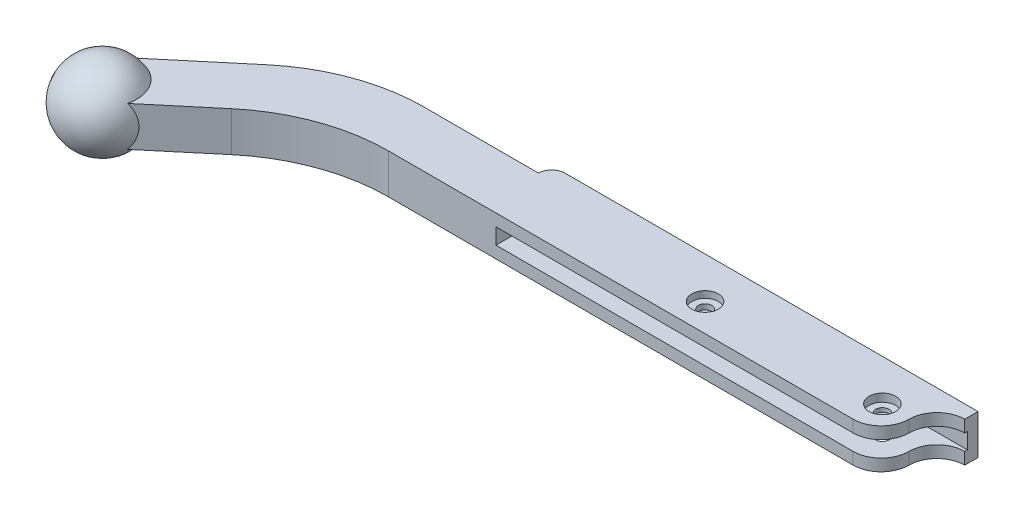
from build123d import *

# Parameters (mm, degrees)
SKETCH_1_W          = 150
SKETCH_1_H          = 21.000000000000004
EXTRUDE_1_DEPTH     = 15
CUT_EXTRUDE_1_DEPTH = 145
SKETCH_3_R          = 5.000000000000004
CUT_EXTRUDE_2_DEPTH = 3
CUT_EXTRUDE_START   = -3
SKETCH_4_R          = 5.000000000000001
CUT_EXTRUDE_3_DEPTH = 3
SKETCH_5_R          = 2.4999999999999987
CUT_EXTRUDE_4_DEPTH = 20
SKETCH_6_R          = 5.000000000000001
CUT_EXTRUDE_5_DEPTH = 20
SKETCH_7_R          = 5.999999999999998
EXTRUDE_2_DEPTH     = 2
SKETCH_8_R          = 6.000000000000003
EXTRUDE_3_DEPTH     = 2
SKETCH_9_R          = 2.500000000000002
CUT_EXTRUDE_6_DEPTH = 20
EXTRUDE_5_DEPTH     = 15
EXTRUDE_6_DEPTH     = 5
FILLET_1_R          = 5
FILLET_2_R          = 10.5
FILLET_3_R          = 67.5
SKETCH_17_W         = 22.000000000000004
SKETCH_17_H         = 5.999999999999995
CUT_EXTRUDE_7_DEPTH = 200


with BuildPart() as part:
    # 草图1 → 凸台-拉伸1 (new body)
    with BuildSketch(Plane(origin=(0, 0, 0), x_dir=(1, 0, 0), z_dir=(0, 1, 0))):
        with Locations((-32.52921535893155, 2.6552587646076753)):
            Rectangle(SKETCH_1_W, SKETCH_1_H)
    extrude(amount=EXTRUDE_1_DEPTH)

    # 草图2 → 切除-拉伸1 (cut)
    with BuildSketch(Plane(origin=(42.470784641068455, 0, 0), x_dir=(0, 0, -1), z_dir=(1, 0, 0))):
        Polygon((-7.844741235392326, 10.499999999999998), (13.155258764607675, 10.499999999999998), (13.155258764607675, 4.500000000000001), (-7.844741235392326, 4.5), align=None)
    extrude(amount=-CUT_EXTRUDE_1_DEPTH, mode=Mode.SUBTRACT)

    # 草图3 → 切除-拉伸2 (cut)
    with BuildSketch(Plane(origin=(0, 15, 0), x_dir=(1, 0, 0), z_dir=(0, 1, 0))):
        with Locations(Location((32.47078464106845, 2.655258764607675, 0), (0, 0, 270))):
            Circle(SKETCH_3_R)
    extrude(amount=-CUT_EXTRUDE_2_DEPTH, mode=Mode.SUBTRACT)

    # 草图4 → 切除-拉伸3 (cut)
    with BuildSketch(Plane(origin=(0, 0, 0), x_dir=(-1, 0, 0), z_dir=(0, -1, 0)).offset(CUT_EXTRUDE_START)):
        with Locations(Location((-32.47078464106845, 2.655258764607675, 0), (0, 0, 270))):
            Circle(SKETCH_4_R)
    extrude(amount=CUT_EXTRUDE_3_DEPTH, mode=Mode.SUBTRACT)

    # 草图5 → 切除-拉伸4 (cut)
    with BuildSketch(Plane(origin=(0, 3, 0), x_dir=(-1, 0, 0), z_dir=(0, -1, 0))):
        with Locations(Location((-32.47078464106845, 2.655258764607675, 0), (0, 0, 270))):
            Circle(SKETCH_5_R)
    extrude(amount=-CUT_EXTRUDE_4_DEPTH, mode=Mode.SUBTRACT)

    # 草图6 → 切除-拉伸5 (cut)
    with BuildSketch(Plane(origin=(0, 15, 0), x_dir=(1, 0, 0), z_dir=(0, 1, 0))):
        with Locations(Location((-34.295534758931545, 2.655258764607675, 0), (0, 0, 270))):
            Circle(SKETCH_6_R)
    extrude(amount=-CUT_EXTRUDE_5_DEPTH, mode=Mode.SUBTRACT)

    # 草图7 → 凸台-拉伸2 (add)
    with BuildSketch(Plane(origin=(0, 4.5, 1.9e-16), x_dir=(1, 0, 0), z_dir=(0, 1, 4e-17))):
        with Locations((-34.295534758931545, 2.655258764607675)):
            Circle(SKETCH_7_R)
    extrude(amount=-EXTRUDE_2_DEPTH)

    # 草图8 → 凸台-拉伸3 (add)
    with BuildSketch(Plane(origin=(0, 10.499999999999998, 0), x_dir=(-1, 0, 0), z_dir=(0, -1, 0))):
        with Locations((34.295534758931545, 2.655258764607675)):
            Circle(SKETCH_8_R)
    extrude(amount=-EXTRUDE_3_DEPTH)

    # 草图9 → 切除-拉伸6 (cut)
    with BuildSketch(Plane(origin=(0, 12.499999999999998, 0), x_dir=(1, 0, 0), z_dir=(0, 1, 0))):
        with Locations(Location((-34.295534758931545, 2.655258764607675, 0), (0, 0, 270))):
            Circle(SKETCH_9_R)
    extrude(amount=-CUT_EXTRUDE_6_DEPTH, mode=Mode.SUBTRACT)



with BuildPart() as body_2:
    # 草图12 → 凸台-拉伸5 (new body)
    with BuildSketch(Plane(origin=(0, 15, 0), x_dir=(1, 0, 0), z_dir=(0, 1, 0))):
        Polygon((-107.52921535893154, -7.844741235392326), (-167.52921535893154, -7.844741235392335), (-213.49188194607015, -46.41199781658475), (-226.9904217494875, -30.32506451108624), (-175.17259027852143, 13.155258764607666), (-107.52921535893154, 13.155258764607675), align=None)
    extrude(amount=-EXTRUDE_5_DEPTH)

    # 草图13 → 旋转3 (revolve)
    with BuildSketch(Plane(origin=(-148.13562673762334, 0, 124.30054975975524), x_dir=(0.6427876096865401, 0, 0.7660444431189775), z_dir=(-0.7660444431189775, 0, 0.6427876096865401))):
        with BuildLine():
            Line((-112.17628346215061, 22.5), (-112.17628346215061, -7.5))
            ThreePointArc((-112.17628346215061, -7.5), (-97.17628346215061, 7.5), (-112.17628346215061, 22.5))
        make_face()
    revolve(axis=Axis((-220.2411518477789, 22.5, 38.36853116383551), (0, -1, 0)))


with BuildPart() as part_1:
    add(part.part)

    add(body_2.part)  # 凸台-拉伸6 merges body 2
    # 草图14 → 凸台-拉伸6 (add)
    with BuildSketch(Plane(origin=(0, 0, -13.155258764607675), x_dir=(-1, 0, 0), z_dir=(0, 0, -1))):
        Polygon((107.52921535893154, 15), (-52.97078464106847, 14.99999999999998), (-52.97078464106847, -3.99e-14), (107.52921535893154, 0), align=None)
    extrude(amount=EXTRUDE_6_DEPTH)

    # 圆角1
    fillet_1_edges = [part_1.edges().sort_by_distance(p)[0] for p in [
        (-107.52921535893154, 7.5, -18.155258764607673),
    ]]
    fillet(fillet_1_edges, radius=FILLET_1_R - 0.0001)  # a hair under: the kernel refuses the full size

    # 圆角2
    fillet_2_edges = [part_1.edges().sort_by_distance(p)[0] for p in [
        (42.470784641068455, 12.75, -13.155258764607675),
    ]]
    fillet(fillet_2_edges, radius=FILLET_2_R - 0.0001)  # a hair under: the kernel refuses the full size
    fillet_2_2_edges = [part_1.edges().sort_by_distance(p)[0] for p in [
        (42.470784641068455, 2.2500000000000004, -13.155258764607675),
    ]]
    fillet(fillet_2_2_edges, radius=FILLET_2_R - 0.0001)  # a hair under: the kernel refuses the full size
    fillet_2_3_edges = [part_1.edges().sort_by_distance(p)[0] for p in [
        (42.470784641068455, 2.25, 7.844741235392326),
    ]]
    fillet(fillet_2_3_edges, radius=FILLET_2_R)
    fillet_2_4_edges = [part_1.edges().sort_by_distance(p)[0] for p in [
        (42.470784641068455, 12.75, 7.844741235392326),
    ]]
    fillet(fillet_2_4_edges, radius=FILLET_2_R)

    # 圆角3
    fillet_3_edges = [part_1.edges().sort_by_distance(p)[0] for p in [
        (-167.52921535893154, 7.5, 7.844741235392335),
        (-175.17259027852143, 7.5, -13.155258764607666),
    ]]
    fillet(fillet_3_edges, radius=FILLET_3_R)

    # 草图17 → 切除-拉伸7 (cut)
    with BuildSketch(Plane(origin=(-102.52921535893152, 0, 0), x_dir=(0, 0, -1), z_dir=(1, 0, 0))):
        with Locations((3.1552587646076753, 7.500000000000001)):
            Rectangle(SKETCH_17_W, SKETCH_17_H)
    extrude(amount=CUT_EXTRUDE_7_DEPTH, mode=Mode.SUBTRACT)


solid = part_1.part
